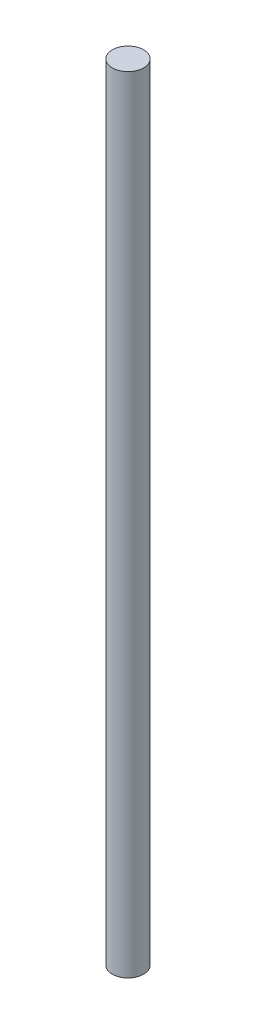
from build123d import *

# Parameters (mm, degrees)
SKETCH1_R           = 1
BOSS_EXTRUDE1_DEPTH = 50


with BuildPart() as part:
    # Sketch1 → Boss-Extrude1 (new body)
    with BuildSketch(Plane(origin=(0, 0, 0), x_dir=(1, 0, 0), z_dir=(0, 1, 0))):
        Circle(SKETCH1_R)
    extrude(amount=BOSS_EXTRUDE1_DEPTH)


solid = part.part
